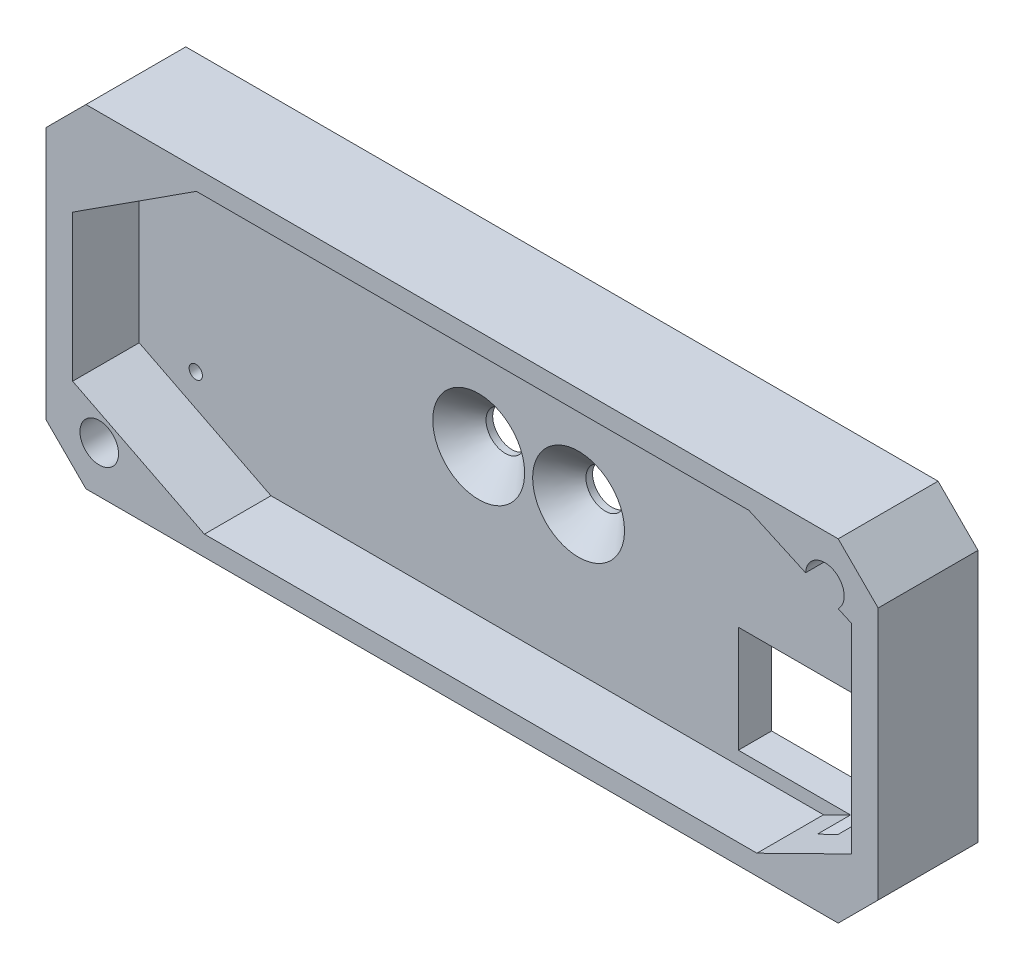
from build123d import *

# Parameters (mm, degrees)
SKETCH_1_W          = 62.5
SKETCH_1_H          = 25
EXTRUDE_1_DEPTH     = 2.5
SKETCH_2_R          = 1.45
CUT_EXTRUDE_1_DEPTH = 3.5
CHAMFER_1_SIZE      = 2
SKETCH_3_W          = 62.5
SKETCH_3_H          = 25
EXTRUDE_2_DEPTH     = 5
SKETCH_4_W          = 10
SKETCH_4_H          = 8
CUT_EXTRUDE_2_DEPTH = 5
SKETCH_5_W          = 67.566121691
SKETCH_5_H          = 29.988395665
CUT_EXTRUDE_3_DEPTH = 10
SKETCH_7_R          = 1.45
CUT_EXTRUDE_4_DEPTH = 10
SKETCH_10_R         = 0.5
CUT_EXTRUDE_5_DEPTH = 10


with BuildPart() as part:
    # Эскиз1 → Бобышка-Вытянуть1 (new body)
    with BuildSketch(Plane.XY):
        Rectangle(SKETCH_1_W, SKETCH_1_H)
    extrude(amount=EXTRUDE_1_DEPTH)

    # Эскиз2 → Вырез-Вытянуть1 (cut)
    with BuildSketch(Plane.XY.offset(2.5)):
        with Locations((3.75, 0)):
            Circle(SKETCH_2_R)
        with Locations((-3.75, 0)):
            Circle(SKETCH_2_R)
    extrude(amount=-CUT_EXTRUDE_1_DEPTH, mode=Mode.SUBTRACT)

    # Фаска1
    chamfer_1_edges = [part.edges().sort_by_distance(p)[0] for p in [
        (-5.2, 0, 2.5),
        (2.3, 0, 2.5),
    ]]
    chamfer(chamfer_1_edges, length=CHAMFER_1_SIZE)

    # Эскиз3 → Бобышка-Вытянуть2 (add)
    with BuildSketch(Plane.XY.offset(2.5)):
        Rectangle(SKETCH_3_W, SKETCH_3_H)
        Polygon((-29.25, -6), (-29.25, 5), (-19.95, 11), (21.55, 11), (29.25, 7.5), (29.25, -7.5), (22.14795897, -11), (-19.35204103, -11), align=None, mode=Mode.SUBTRACT)
    extrude(amount=EXTRUDE_2_DEPTH)

    # Эскиз4 → Вырез-Вытянуть2 (cut)
    with BuildSketch(Plane(origin=(0, 0, 0), x_dir=(-1, 0, 0), z_dir=(0, 0, -1))):
        with Locations((-20.75, -6)):
            Rectangle(SKETCH_4_W, SKETCH_4_H)
    extrude(amount=-CUT_EXTRUDE_2_DEPTH, mode=Mode.SUBTRACT)

    # Эскиз5 → Вырез-Вытянуть3 (cut)
    with BuildSketch(Plane.XY.offset(7.5)):
        with Locations((0.466014855, 0.289583976)):
            Rectangle(SKETCH_5_W, SKETCH_5_H)
        Polygon((-28.25, 12.5), (-31.25, 9.5), (-31.25, -9.5), (-28.25, -12.5), (28.25, -12.5), (31.25, -9.5), (31.25, 9.5), (28.25, 12.5), align=None, mode=Mode.SUBTRACT)
    extrude(amount=-CUT_EXTRUDE_3_DEPTH, mode=Mode.SUBTRACT)

    # Эскиз7 → Вырез-Вытянуть4 (cut)
    with BuildSketch(Plane.XY.offset(7.5)):
        with Locations((-27.25, -9)):
            Circle(SKETCH_7_R)
        with Locations((27.25, 9)):
            Circle(SKETCH_7_R)
    extrude(amount=-CUT_EXTRUDE_4_DEPTH, mode=Mode.SUBTRACT)

    # Эскиз10 → Вырез-Вытянуть5 (cut)
    with BuildSketch(Plane.XY.offset(2.5)):
        with Locations((-25, -5.766085635)):
            Circle(SKETCH_10_R)
        with Locations((26.547958971, 6)):
            Circle(SKETCH_10_R)
    extrude(amount=-CUT_EXTRUDE_5_DEPTH, mode=Mode.SUBTRACT)


solid = part.part
